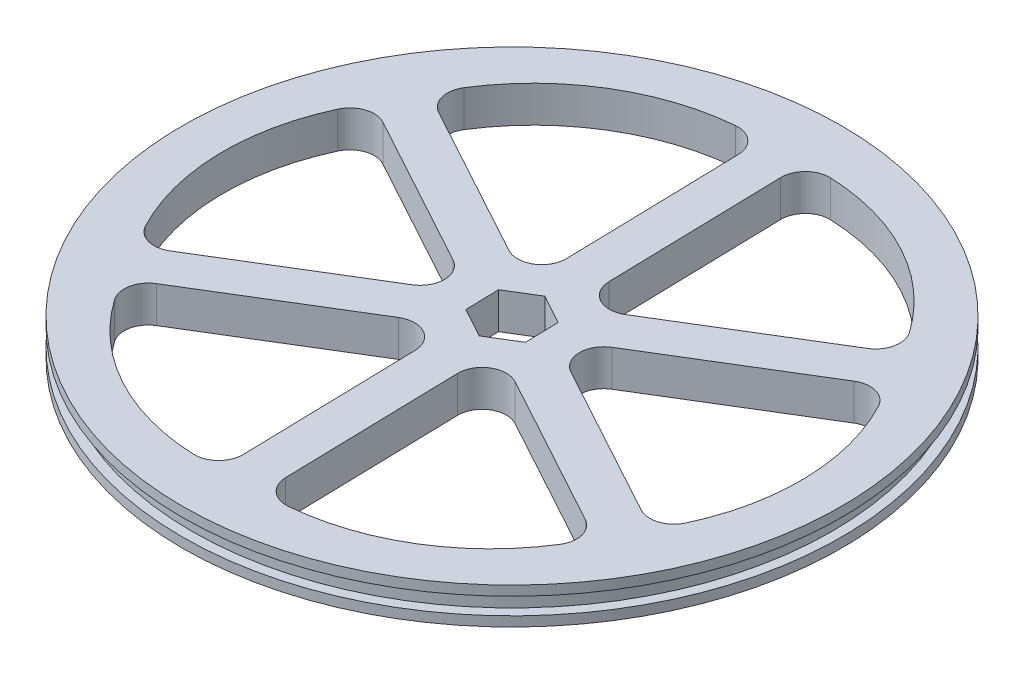
from build123d import *

# Parameters (mm, degrees)
SKETCH1_R                = 66
BOSS_EXTRUDE1_DEPTH      = 7.5
SKETCH1_4_R              = 68
SKETCH1_4_R_2            = 66
BOSS_EXTRUDE3_DEPTH      = 2
BOSS_EXTRUDE4_START      = -2
SKETCH4_R                = 68
BOSS_EXTRUDE4_DEPTH      = 2
CUT_EXTRUDE1_DEPTH       = 97.458540317
CUT_EXTRUDE2_DEPTH       = 97.458540317
FILLET1_R                = 5
CIRPATTERN1_COUNT        = 6
FILLET1_OF_CIRPATTERN1_R = 5


with BuildPart() as part:
    # Sketch1 → Boss-Extrude1 (new body)
    with BuildSketch(Plane(origin=(0, 0, 0), x_dir=(1, 0, 0), z_dir=(0, 1, 0))):
        Circle(SKETCH1_R)
    extrude(amount=BOSS_EXTRUDE1_DEPTH)

    # Sketch1<4> → Boss-Extrude3 (add)
    with BuildSketch(Plane(origin=(0, 0, 0), x_dir=(1, 0, 0), z_dir=(0, 1, 0))):
        Circle(SKETCH1_4_R)
        Circle(SKETCH1_4_R_2, mode=Mode.SUBTRACT)
    extrude(amount=BOSS_EXTRUDE3_DEPTH)

    # Sketch4 → Boss-Extrude4 (add)
    with BuildSketch(Plane(origin=(0, 7.5, 0), x_dir=(1, 0, 0), z_dir=(0, 1, 0)).offset(BOSS_EXTRUDE4_START)):
        Circle(SKETCH4_R)
    extrude(amount=BOSS_EXTRUDE4_DEPTH)

    # Sketch6 → Cut-Extrude1 (cut, through all)
    with BuildSketch(Plane(origin=(0, 7.5, 0), x_dir=(1, 0, 0), z_dir=(0, 1, 0))):
        Polygon((-6.082238944, 3.317584879), (-5.914232256, -3.608580998), (0.168006688, -6.926165877), (6.082238944, -3.317584879), (5.914232256, 3.608580998), (-0.168006688, 6.926165877), align=None)
    extrude(amount=-CUT_EXTRUDE1_DEPTH, mode=Mode.SUBTRACT)

    # Sketch7 → Cut-Extrude2 (cut, through all)
    with BuildSketch(Plane(origin=(0, 7.5, 0), x_dir=(1, 0, 0), z_dir=(0, 1, 0))):
        with BuildLine():
            Line((-4.427257323, 7.255990118), (-48.322035968, 31.198596652))
            ThreePointArc((-48.322035968, 31.198596652), (-30.84284899, 50.549446572), (-5.639741154, 57.241286786))
            Line((-5.639741154, 57.241286786), (-4.427257323, 7.255990118))
        make_face()
    cut_extrude2 = extrude(amount=-CUT_EXTRUDE2_DEPTH, mode=Mode.SUBTRACT)

    # Fillet1
    fillet1_edges = [part.edges().sort_by_distance(p)[0] for p in [
        (-4.427257323, 3.75, -7.255990118),
        (-5.639741154, 3.75, -57.241286786),
        (-48.322035968, 3.75, -31.198596652),
    ]]
    fillet(fillet1_edges, radius=FILLET1_R)

    # CirPattern1: Cut-Extrude2 ×6 about axis
    cirpattern1_axis = Axis((0, 0, 0), (0, 1, 0))
    for i in range(1, CIRPATTERN1_COUNT):
        add(cut_extrude2.rotate(cirpattern1_axis, i * 360 / CIRPATTERN1_COUNT), mode=Mode.SUBTRACT)

    # Fillet1 of CirPattern1
    fillet1_of_cirpattern1_edges = [part.edges().sort_by_distance(p)[0] for p in [
        (-8.497500434, 3.75, 0.206122251),
        (-52.392279079, 3.75, -23.736484283),
        (-51.179795248, 3.75, 26.248812385),
        (-4.070243111, 3.75, 7.46211237),
        (-46.752537925, 3.75, 33.504802503),
        (-2.857759279, 3.75, 57.447409037),
        (4.427257323, 3.75, 7.255990118),
        (5.639741154, 3.75, 57.241286786),
        (48.322035968, 3.75, 31.198596652),
        (8.497500434, 3.75, -0.206122251),
        (52.392279079, 3.75, 23.736484283),
        (51.179795248, 3.75, -26.248812385),
        (4.070243111, 3.75, -7.46211237),
        (46.752537925, 3.75, -33.504802503),
        (2.857759279, 3.75, -57.447409037),
    ]]
    fillet(fillet1_of_cirpattern1_edges, radius=FILLET1_OF_CIRPATTERN1_R)


solid = part.part
